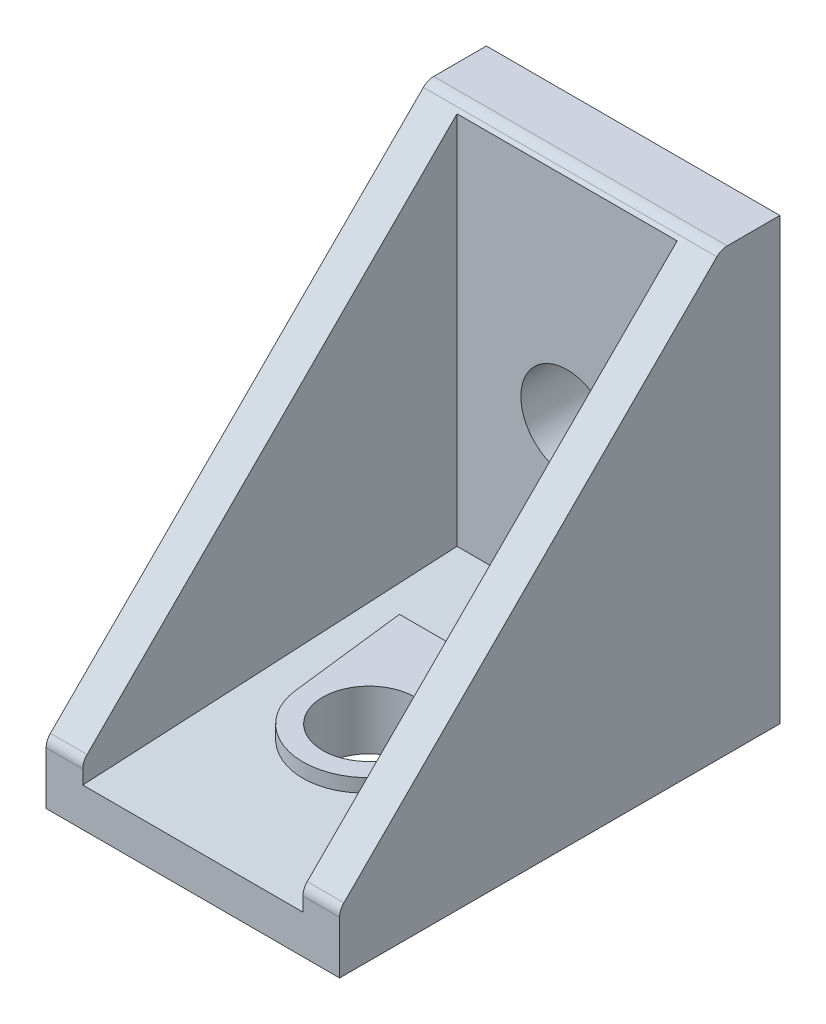
from build123d import *
from build123d.topology import SkipClean

# Parameters (mm, degrees)
BOSS_EXTRUDE1_DEPTH      = 10
BOSS_EXTRUDE1_DEPTH_BACK = 10
CUT_EXTRUDE1_DEPTH       = 7.5
CUT_EXTRUDE1_DEPTH_BACK  = 7.5
BOSS_EXTRUDE2_DEPTH      = 2
SKETCH4_R                = 3.15
CUT_EXTRUDE2_DEPTH       = 5
SKETCH5_R                = 3.15
CUT_EXTRUDE3_DEPTH       = 4
SKETCH6_W                = 20
SKETCH6_H                = 30
BOSS_EXTRUDE3_DEPTH      = 1
SKETCH7_W                = 20
SKETCH7_H                = 30
CUT_EXTRUDE4_DEPTH       = 1
SKETCH8_W                = 20
SKETCH8_H                = 30
BOSS_EXTRUDE4_DEPTH      = 1
CUT_EXTRUDE5_START       = -1
SKETCH9_W                = 20
SKETCH9_H                = 30
CUT_EXTRUDE5_DEPTH       = 1


with BuildPart() as part:
    # Sketch1 → Boss-Extrude1 (new, two sides: drawn at the far end of the back side and taken through both)
    with BuildSketch(Plane(origin=(0, 0, 0), x_dir=(0, 0, -1), z_dir=(1, 0, 0)).offset(-BOSS_EXTRUDE1_DEPTH_BACK)):
        with BuildLine():
            Line((-30, 0), (0, 0))
            Line((0, 0), (0, 30))
            Line((0, 30), (-3.585786438, 30))
            ThreePointArc((-3.585786438, 30), (-3.96846987, 29.923879533), (-4.292893219, 29.707106781))
            Line((-4.292893219, 29.707106781), (-29.707106781, 4.292893219))
            ThreePointArc((-29.707106781, 4.292893219), (-29.923879533, 3.96846987), (-30, 3.585786438))
            Line((-30, 3.585786438), (-30, 0))
        make_face()
    extrude(amount=BOSS_EXTRUDE1_DEPTH + BOSS_EXTRUDE1_DEPTH_BACK)

    # Sketch2 → Cut-Extrude1 (cut, two sides: drawn at the far end of the back side and taken through both)
    with BuildSketch(Plane(origin=(0, 0, 0), x_dir=(0, 0, -1), z_dir=(1, 0, 0)).offset(-CUT_EXTRUDE1_DEPTH_BACK)):
        Polygon((-34, 2.427766622), (-4.5, 3.97379611), (-4.5, 34), (-34, 34), align=None)
    extrude(amount=CUT_EXTRUDE1_DEPTH + CUT_EXTRUDE1_DEPTH_BACK, mode=Mode.SUBTRACT)

    # Sketch3 → Boss-Extrude2 (add)
    with BuildSketch(Plane(origin=(0, 4, 0), x_dir=(1, 0, 0), z_dir=(0, 1, 0))):
        with BuildLine():
            Line((-5.420884207, -10.5), (-4.4686916, -18.529901296))
            ThreePointArc((-4.4686916, -18.529901296), (0, -22.5), (4.4686916, -18.529901296))
            Line((4.4686916, -18.529901296), (5.420884207, -10.5))
            Line((5.420884207, -10.5), (-5.420884207, -10.5))
        make_face()
    extrude(amount=-BOSS_EXTRUDE2_DEPTH)

    # Sketch4 → Cut-Extrude2 (cut)
    with BuildSketch(Plane.XY):
        with Locations((0, 15)):
            Circle(SKETCH4_R)
    extrude(amount=CUT_EXTRUDE2_DEPTH, mode=Mode.SUBTRACT)

    # Sketch5 → Cut-Extrude3 (cut)
    with BuildSketch(Plane(origin=(0, 0, 0), x_dir=(1, 0, 0), z_dir=(0, 1, 0))):
        with Locations((0, -18)):
            Circle(SKETCH5_R)
    extrude(amount=CUT_EXTRUDE3_DEPTH, mode=Mode.SUBTRACT)

    # Sketch6 → Boss-Extrude3 (add)
    with BuildSketch(Plane(origin=(0, 0, 0), x_dir=(1, 0, 0), z_dir=(0, 1, 0))):
        with Locations((0, -15)):
            Rectangle(SKETCH6_W, SKETCH6_H)
    extrude(amount=-BOSS_EXTRUDE3_DEPTH)

    # Sketch7 → Cut-Extrude4 (cut)
    with BuildSketch(Plane(origin=(0, 0, 0), x_dir=(1, 0, 0), z_dir=(0, 1, 0))):
        with Locations((0, -15)):
            Rectangle(SKETCH7_W, SKETCH7_H)
        with BuildLine():
            Line((-3.7, -13), (3.7, -13))
            ThreePointArc((3.7, -13), (3.912132034, -12.912132034), (4, -12.7))
            Line((4, -12.7), (4, -5.3))
            ThreePointArc((4, -5.3), (3.912132034, -5.087867966), (3.7, -5))
            Line((3.7, -5), (-3.7, -5))
            ThreePointArc((-3.7, -5), (-3.912132034, -5.087867966), (-4, -5.3))
            Line((-4, -5.3), (-4, -12.7))
            ThreePointArc((-4, -12.7), (-3.912132034, -12.912132034), (-3.7, -13))
        make_face(mode=Mode.SUBTRACT)
        with BuildLine():
            Line((-3.7, -27), (3.7, -27))
            ThreePointArc((3.7, -27), (3.912132034, -26.912132034), (4, -26.7))
            Line((4, -26.7), (4, -24.3))
            ThreePointArc((4, -24.3), (3.912132034, -24.087867966), (3.7, -24))
            Line((3.7, -24), (-3.7, -24))
            ThreePointArc((-3.7, -24), (-3.912132034, -24.087867966), (-4, -24.3))
            Line((-4, -24.3), (-4, -26.7))
            ThreePointArc((-4, -26.7), (-3.912132034, -26.912132034), (-3.7, -27))
        make_face(mode=Mode.SUBTRACT)
    extrude(amount=-CUT_EXTRUDE4_DEPTH, mode=Mode.SUBTRACT)

    # Sketch8 → Boss-Extrude4 (add)
    with BuildSketch(Plane.XY):
        with Locations((0, 15)):
            Rectangle(SKETCH8_W, SKETCH8_H)
    extrude(amount=-BOSS_EXTRUDE4_DEPTH)

    # Sketch9 → Cut-Extrude5 (cut)
    with SkipClean():  # the faces are left unmerged after this step: merging them gives an invalid solid
        with BuildSketch(Plane.XY.offset(CUT_EXTRUDE5_START)):
            with Locations((0, 15)):
                Rectangle(SKETCH9_W, SKETCH9_H)
            with BuildLine():
                Line((0.5, 11), (3, 11))
                ThreePointArc((3, 11), (3.707106781, 11.292893219), (4, 12))
                Line((4, 12), (4, 14.5))
                Line((4, 14.5), (3.110064308, 14.5))
                ThreePointArc((3.110064308, 14.5), (2.227386361, 12.772613639), (0.5, 11.889935692))
                Line((0.5, 11.889935692), (0.5, 11))
            make_face(mode=Mode.SUBTRACT)
            with BuildLine():
                Line((0.5, 19), (0.5, 18.110064308))
                ThreePointArc((0.5, 18.110064308), (2.227386361, 17.227386361), (3.110064308, 15.5))
                Line((3.110064308, 15.5), (4, 15.5))
                Line((4, 15.5), (4, 18))
                ThreePointArc((4, 18), (3.707106781, 18.707106781), (3, 19))
                Line((3, 19), (0.5, 19))
            make_face(mode=Mode.SUBTRACT)
            with BuildLine():
                Line((-3, 11), (-0.5, 11))
                Line((-0.5, 11), (-0.5, 11.889935692))
                ThreePointArc((-0.5, 11.889935692), (-2.227386361, 12.772613639), (-3.110064308, 14.5))
                Line((-3.110064308, 14.5), (-4, 14.5))
                Line((-4, 14.5), (-4, 12))
                ThreePointArc((-4, 12), (-3.707106781, 11.292893219), (-3, 11))
            make_face(mode=Mode.SUBTRACT)
            with BuildLine():
                Line((-4, 15.5), (-3.110064308, 15.5))
                ThreePointArc((-3.110064308, 15.5), (-2.227386361, 17.227386361), (-0.5, 18.110064308))
                Line((-0.5, 18.110064308), (-0.5, 19))
                Line((-0.5, 19), (-3, 19))
                ThreePointArc((-3, 19), (-3.707106781, 18.707106781), (-4, 18))
                Line((-4, 18), (-4, 15.5))
            make_face(mode=Mode.SUBTRACT)
        extrude(amount=CUT_EXTRUDE5_DEPTH, mode=Mode.SUBTRACT)


solid = part.part
